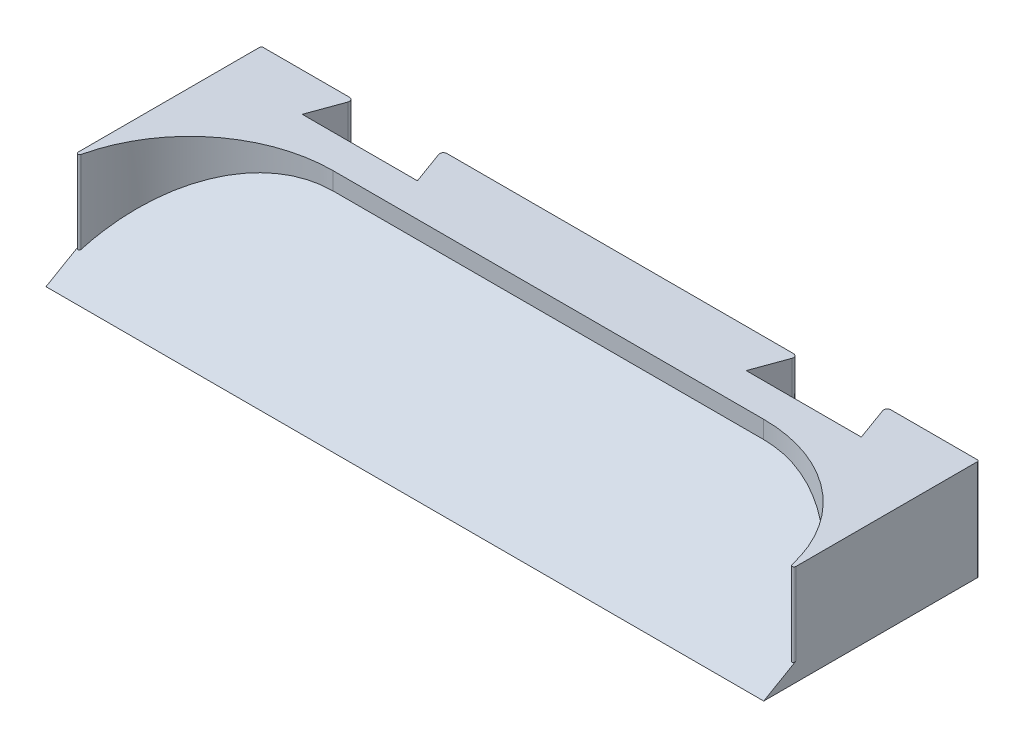
from build123d import *

# Parameters (mm, degrees)
SKETCH_1_W          = 200
SKETCH_1_H          = 60
EXTRUDE_1_DEPTH     = 28
CUT_EXTRUDE_1_DEPTH = 211.675105316
EXTRUDE_2_REACH     = 212.675
FILLET_1_R          = 0.5
CUT_EXTRUDE_START   = 12
CUT_EXTRUDE_2_DEPTH = 199.675105316
CUT_EXTRUDE_START_2 = 10
SKETCH_5_W          = 60
SKETCH_5_H          = 12
CUT_EXTRUDE_3_DEPTH = 221.675105316
SKETCH_6_W          = 12
SKETCH_6_H          = 5
CUT_EXTRUDE_4_DEPTH = 30
FILLET_2_R          = 1


with BuildPart() as part:
    # 草图1 → 凸台-拉伸1 (new body)
    with BuildSketch(Plane(origin=(0, 0, 0), x_dir=(1, 0, 0), z_dir=(0, 1, 0))):
        with Locations((100, -30)):
            Rectangle(SKETCH_1_W, SKETCH_1_H)
    extrude(amount=EXTRUDE_1_DEPTH)

    # 草图2 → 切除-拉伸1 (cut, through all)
    with BuildSketch(Plane(origin=(0, 0, 0), x_dir=(0, 0, -1), z_dir=(1, 0, 0))):
        Polygon((-60, 0), (-20, 23.094010768), (-20, 28), (-60, 28), align=None)
    extrude(amount=CUT_EXTRUDE_1_DEPTH, mode=Mode.SUBTRACT)

    # 凸台-拉伸2: up to this face of the body (flat: up to its plane)
    extrude_2_end = Plane(part.part.faces().sort_by_distance((100, 28, 10))[0])
    # 草图3 → 凸台-拉伸2 (add, up to the picked face)
    with BuildSketch(Plane(origin=(0, 0, 0), x_dir=(1, 0, 0), z_dir=(0, 1, 0)), mode=Mode.PRIVATE) as extrude_2_sk1:
        with BuildLine():
            Line((0, -60), (0, -20))
            Line((0, -20), (40, -20))
            ThreePointArc((40, -20), (11.715728753, -31.715728753), (0, -60))
        make_face()
    extrude_2_tool1 = split(extrude(extrude_2_sk1.sketch, amount=EXTRUDE_2_REACH, mode=Mode.PRIVATE), bisect_by=extrude_2_end, keep=Keep.BOTH, mode=Mode.PRIVATE)
    # 草图3 → 凸台-拉伸2 (add, up to the picked face)
    with BuildSketch(Plane(origin=(0, 0, 0), x_dir=(1, 0, 0), z_dir=(0, 1, 0)), mode=Mode.PRIVATE) as extrude_2_sk2:
        with BuildLine():
            Line((200, -20), (160, -20))
            ThreePointArc((160, -20), (188.284271247, -31.715728753), (200, -60))
            Line((200, -60), (200, -20))
        make_face()
    extrude_2_tool2 = split(extrude(extrude_2_sk2.sketch, amount=EXTRUDE_2_REACH, mode=Mode.PRIVATE), bisect_by=extrude_2_end, keep=Keep.BOTH, mode=Mode.PRIVATE)
    add(extrude_2_tool1.solids().sort_by(Axis((8.934718, 0, 28.934718), (0, 1, 0)))[0])
    add(extrude_2_tool2.solids().sort_by(Axis((191.065282, 0, 28.934718), (0, 1, 0)))[0])

    # 圆角1
    # the kernel refuses this fillet: 0.5 mm, written as the material it takes off along each edge
    with BuildSketch(Plane(origin=(200, -22.360679775, 60), x_dir=(-0.11111111111111022, 0, -0.9938079899999066), z_dir=(0, 1, 0))) as fillet_1_piece_1_section:
        with BuildLine():
            CenterArc((8.944444444, -0.496903995), FILLET_1_R, 96.379370208, 167.241259583)
            Line((8.888888889, -0.99380799), (0, 0))
            ThreePointArc((0, 0), (4.444444444, -0.2476804), (8.888888889, 0))
        make_face()
    fillet_1_piece_1 = extrude(amount=72.72135955, mode=Mode.PRIVATE)
    fillet_1_piece_1 = split(fillet_1_piece_1, bisect_by=Plane(origin=(199.731100006, 6.705360676, 48.385974626), z_dir=(0, 0.8660254037844379, 0.5000000000000012)), keep=Keep.TOP, mode=Mode.PRIVATE)
    add(fillet_1_piece_1, mode=Mode.SUBTRACT)
    with BuildSketch(Plane(origin=(0, -22.360679775, 60), x_dir=(0.11111111111111158, 0, -0.9938079899999065), z_dir=(0, 1, 0))) as fillet_1_piece_2_section:
        with BuildLine():
            CenterArc((8.944444444, 0.496903995), FILLET_1_R, 96.379370208, 167.241259583)
            Line((8.888888889, 0.99380799), (0, 0))
            ThreePointArc((0, 0), (4.444444444, 0.2476804), (8.888888889, 0))
        make_face()
    fillet_1_piece_2 = extrude(amount=72.72135955, mode=Mode.PRIVATE)
    fillet_1_piece_2 = split(fillet_1_piece_2, bisect_by=Plane(origin=(0.268899994, 6.705360676, 48.385974626), z_dir=(0, 0.8660254037844379, 0.5000000000000012)), keep=Keep.TOP, mode=Mode.PRIVATE)
    add(fillet_1_piece_2, mode=Mode.SUBTRACT)
    with BuildSketch(Plane(origin=(0, -1.25, 0), x_dir=(1, 0, 0), z_dir=(0, 1, 0))) as fillet_1_piece_3:
        with BuildLine():
            CenterArc((FILLET_1_R, -FILLET_1_R), FILLET_1_R, 90, 90)
            Line((0, -FILLET_1_R), (0, 0))
            Line((0, 0), (FILLET_1_R, 0))
        make_face()
    extrude(amount=30.5, mode=Mode.SUBTRACT)
    with BuildSketch(Plane(origin=(200, -1.25, 0), x_dir=(-1, 0, 0), z_dir=(0, 1, 0))) as fillet_1_piece_4:
        with BuildLine():
            CenterArc((FILLET_1_R, FILLET_1_R), FILLET_1_R, 180, 90)
            Line((0, FILLET_1_R), (0, 0))
            Line((0, 0), (FILLET_1_R, 0))
        make_face()
    extrude(amount=30.5, mode=Mode.SUBTRACT)

    # 草图4 → 切除-拉伸2 (cut, through all)
    with BuildSketch(Plane(origin=(0, 0, 0), x_dir=(1, 0, 0), z_dir=(0, 1, 0)).offset(CUT_EXTRUDE_START)):
        Polygon((26, 0), (22.105518493, -10.7), (54.194481507, -10.7), (50.3, 0), align=None)
        Polygon((145.805518493, -10.7), (149.7, 0), (174, 0), (177.894481507, -10.7), align=None)
    extrude(amount=CUT_EXTRUDE_2_DEPTH, mode=Mode.SUBTRACT)

    # 草图5 → 切除-拉伸3 (cut, through all)
    with BuildSketch(Plane(origin=(0, 0, 0), x_dir=(1, 0, 0), z_dir=(0, 1, 0)).offset(CUT_EXTRUDE_START_2)):
        with Locations((42, -24)):
            Rectangle(SKETCH_5_W, SKETCH_5_H)
        with Locations((158, -24)):
            Rectangle(SKETCH_5_W, SKETCH_5_H)
    extrude(amount=-CUT_EXTRUDE_3_DEPTH, mode=Mode.SUBTRACT)

    # 草图6 → 切除-拉伸4 (cut)
    with BuildSketch(Plane.XY):
        with Locations((66, 7.5)):
            Rectangle(SKETCH_6_W, SKETCH_6_H)
        with Locations((134, 7.5)):
            Rectangle(SKETCH_6_W, SKETCH_6_H)
    extrude(amount=CUT_EXTRUDE_4_DEPTH, mode=Mode.SUBTRACT)

    # 圆角2
    fillet_2_edges = [part.edges().sort_by_distance(p)[0] for p in [
        (50.3, 20, 0),
        (26, 20, 0),
        (174, 20, 0),
        (149.7, 20, 0),
        (66, 5, 0),
        (66, 10, 0),
        (60, 7.5, 0),
        (72, 7.5, 0),
        (66, 5, 18),
        (134, 10, 0),
        (134, 5, 0),
        (128, 7.5, 0),
        (140, 7.5, 0),
        (134, 5, 18),
    ]]
    fillet(fillet_2_edges, radius=FILLET_2_R)


solid = part.part
